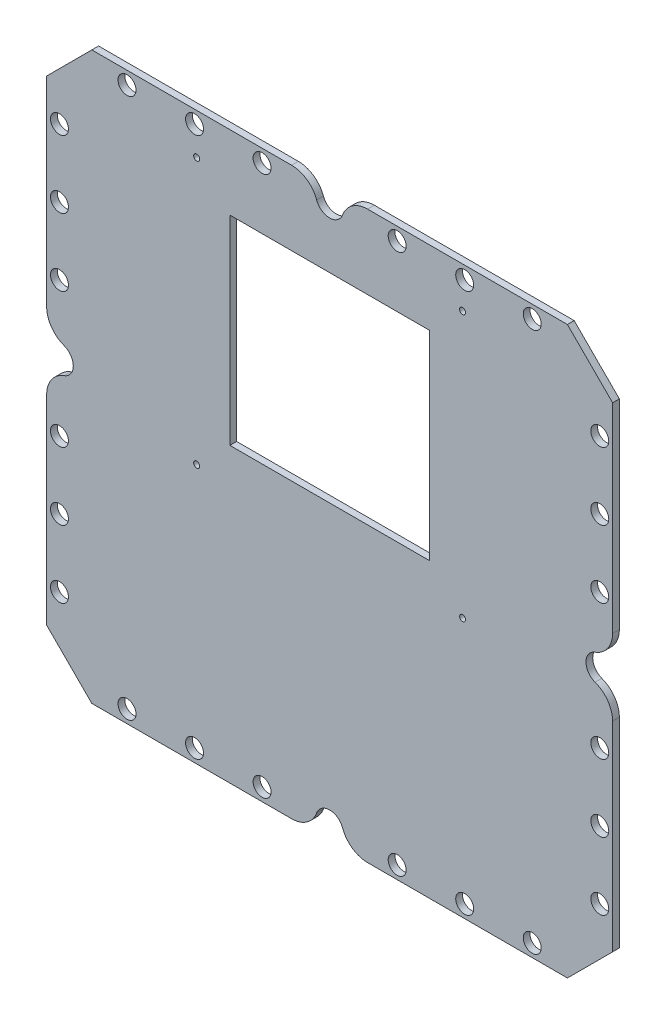
from build123d import *

# Parameters (mm, degrees)
SKETCH1_R             = 3.379999993
SKETCH1_R_2           = 3.379999996
SKETCH1_R_3           = 1.13
SKETCH1_R_4           = 3.379999998
SKETCH1_R_5           = 3.38
SKETCH1_W             = 75
SKETCH1_H             = 75
BOSS_EXTRUDE1_DEPTH   = 2.54
F_4_40_TAPPED_HOLE1_D = 2.2606
FILLET1_R             = 10


with BuildPart() as part:
    # Sketch1 → Boss-Extrude1 (new body)
    with BuildSketch(Plane.XY):
        with BuildLine():
            Line((101.2317, 0), (16.997849999, 0))
            Line((16.997849999, 0), (0, -16.997849999))
            Line((0, -16.997849999), (0, -101.231700004))
            Line((0, -101.231700004), (4.825999998, -101.231700004))
            ThreePointArc((4.825999998, -101.231700008), (10.020299993, -106.426000003), (4.825999998, -111.620299998))
            Line((4.825999998, -111.620300003), (0, -111.620300003))
            Line((0, -111.620300003), (0, -195.854150007))
            Line((0, -195.854150007), (16.997849999, -212.852000007))
            Line((16.997849999, -212.852000007), (101.2317, -212.852000007))
            Line((101.2317, -212.852000007), (101.2317, -208.026000005))
            ThreePointArc((101.231700007, -208.026000005), (106.426, -202.831700013), (111.620299993, -208.026000005))
            Line((111.620299999, -208.026000005), (111.620299999, -212.852000007))
            Line((111.620299999, -212.852000007), (195.854150007, -212.852000007))
            Line((195.854150007, -212.852000007), (212.852000007, -195.854150007))
            Line((212.852000007, -195.854150007), (212.852000007, -111.620300003))
            Line((212.852000007, -111.620300003), (208.026000002, -111.620300003))
            ThreePointArc((208.026000002, -111.6203), (202.831700005, -106.426000003), (208.026000002, -101.231700006))
            Line((208.026000002, -101.231700004), (212.852000007, -101.231700004))
            Line((212.852000007, -101.231700004), (212.852000007, -16.997849999))
            Line((212.852000007, -16.997849999), (195.854150007, 0))
            Line((195.854150007, 0), (111.620299999, 0))
            Line((111.620299999, 0), (111.620299999, -4.826000001))
            ThreePointArc((111.620299999, -4.826000001), (106.426, -10.020300001), (101.2317, -4.826000001))
            Line((101.2317, -4.826000001), (101.2317, 0))
        make_face()
        with Locations((30.226, -208.026000005)):
            Circle(SKETCH1_R, mode=Mode.SUBTRACT)
        with Locations((4.825999998, -182.626000003)):
            Circle(SKETCH1_R_2, mode=Mode.SUBTRACT)
        with Locations((55.626, -208.026000005)):
            Circle(SKETCH1_R, mode=Mode.SUBTRACT)
        with Locations((81.026, -208.026000005)):
            Circle(SKETCH1_R, mode=Mode.SUBTRACT)
        with Locations((4.825999998, -157.226000003)):
            Circle(SKETCH1_R_2, mode=Mode.SUBTRACT)
        with Locations((4.825999998, -131.826000003)):
            Circle(SKETCH1_R_2, mode=Mode.SUBTRACT)
        with Locations((56.426000003, -115.34289)):
            Circle(SKETCH1_R_3, mode=Mode.SUBTRACT)
        with Locations((131.826, -208.026000005)):
            Circle(SKETCH1_R, mode=Mode.SUBTRACT)
        with Locations((157.226, -208.026000005)):
            Circle(SKETCH1_R, mode=Mode.SUBTRACT)
        with Locations((182.626, -208.026000005)):
            Circle(SKETCH1_R, mode=Mode.SUBTRACT)
        with Locations((208.026000002, -182.626000003)):
            Circle(SKETCH1_R_4, mode=Mode.SUBTRACT)
        with Locations((156.426000003, -115.34289)):
            Circle(SKETCH1_R_3, mode=Mode.SUBTRACT)
        with Locations((208.026000002, -157.226000003)):
            Circle(SKETCH1_R_4, mode=Mode.SUBTRACT)
        with Locations((208.026000002, -131.826000003)):
            Circle(SKETCH1_R_4, mode=Mode.SUBTRACT)
        with Locations((4.825999998, -81.026000003)):
            Circle(SKETCH1_R_2, mode=Mode.SUBTRACT)
        with Locations((4.825999998, -55.626000003)):
            Circle(SKETCH1_R_2, mode=Mode.SUBTRACT)
        with Locations((4.825999998, -30.226000003)):
            Circle(SKETCH1_R_2, mode=Mode.SUBTRACT)
        with Locations((30.226, -4.826000001)):
            Circle(SKETCH1_R_5, mode=Mode.SUBTRACT)
        with Locations((56.426000003, -15.34289)):
            Circle(SKETCH1_R_3, mode=Mode.SUBTRACT)
        with Locations((55.626, -4.826000001)):
            Circle(SKETCH1_R_5, mode=Mode.SUBTRACT)
        with Locations((81.026, -4.826000001)):
            Circle(SKETCH1_R_5, mode=Mode.SUBTRACT)
        with Locations((106.426000003, -65.34289)):
            Rectangle(SKETCH1_W, SKETCH1_H, mode=Mode.SUBTRACT)
        with Locations((208.026000002, -81.026000003)):
            Circle(SKETCH1_R_4, mode=Mode.SUBTRACT)
        with Locations((208.026000002, -55.626000003)):
            Circle(SKETCH1_R_4, mode=Mode.SUBTRACT)
        with Locations((131.826, -4.826000001)):
            Circle(SKETCH1_R_5, mode=Mode.SUBTRACT)
        with Locations((156.426000003, -15.34289)):
            Circle(SKETCH1_R_3, mode=Mode.SUBTRACT)
        with Locations((157.226, -4.826000001)):
            Circle(SKETCH1_R_5, mode=Mode.SUBTRACT)
        with Locations((208.026000002, -30.226000003)):
            Circle(SKETCH1_R_4, mode=Mode.SUBTRACT)
        with Locations((182.626, -4.826000001)):
            Circle(SKETCH1_R_5, mode=Mode.SUBTRACT)
    extrude(amount=BOSS_EXTRUDE1_DEPTH)

    # #4-40 Tapped Hole1 (through all)
    with Locations(Plane(origin=(56.426000003, -15.34289, 2.54), x_dir=(1, 0, 0), z_dir=(0, 0, 1))):
        with Locations((0, 0), (100, 0), (100, -100), (0, -100)):
            Hole(F_4_40_TAPPED_HOLE1_D / 2)

    # Fillet1
    fillet1_edges = [part.edges().sort_by_distance(p)[0] for p in [
        (101.2317, -212.852000007, 1.27),
        (111.620299999, -212.852000007, 1.27),
        (212.852000007, -111.620300003, 1.27),
        (212.852000007, -101.231700004, 1.27),
        (111.620299999, 0, 1.27),
        (101.2317, 0, 1.27),
        (0, -111.620300003, 1.27),
        (0, -101.231700004, 1.27),
    ]]
    fillet(fillet1_edges, radius=FILLET1_R)


solid = part.part
